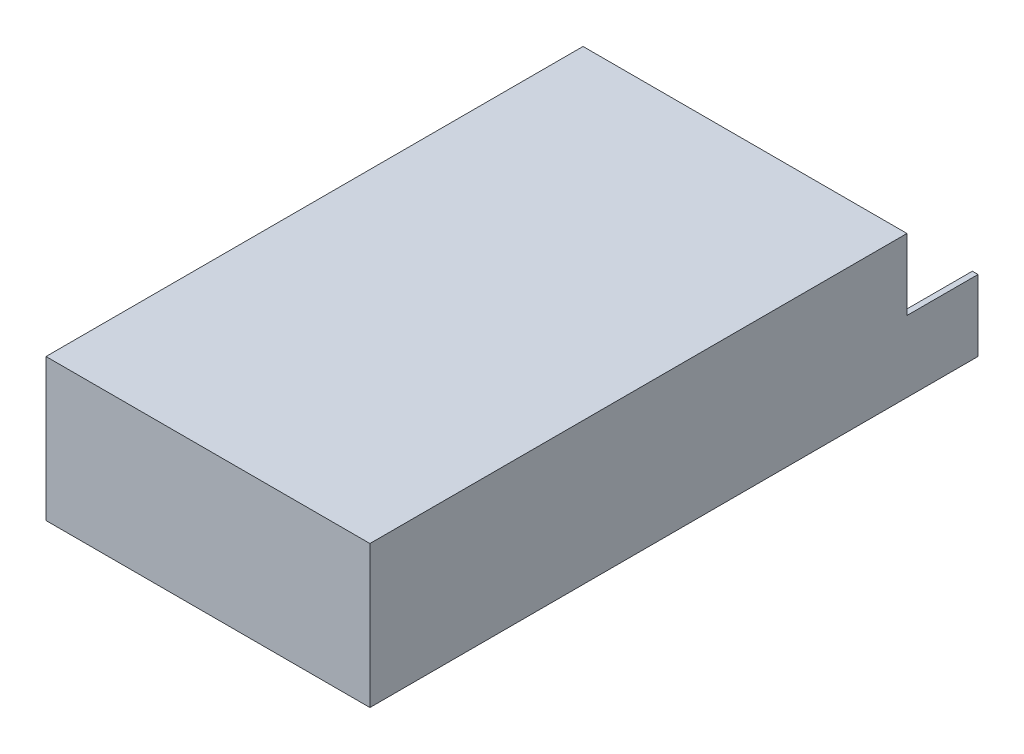
from build123d import *

# Parameters (mm, degrees)
SKETCH1_W                = 114
SKETCH1_H                = 214
BOSS_EXTRUDE1_DEPTH      = 50
SKETCH4_W                = 25
SKETCH4_H                = 25
CUT_EXTRUDE1_DEPTH       = 248.572211688
SHELL1_START             = 2
SHELL1_OUTLINE_W         = 110
SHELL1_OUTLINE_H         = 185
SHELL1_DEPTH             = 46
SHELL1_2_OUTLINE_W       = 110
SHELL1_2_OUTLINE_H       = 27
SHELL1_2_DEPTH           = 23
M4_CLEARANCE_HOLE1_D     = 4.3
M4_CLEARANCE_HOLE1_DEPTH = 4
M4_CLEARANCE_HOLE1_TIP   = 1.291850331


# Read off the part's stored shape, not the designer's step: Shell1
with BuildPart() as part:
    # Sketch1 → Boss-Extrude1 (new body)
    with BuildSketch(Plane(origin=(0, 0, 0), x_dir=(1, 0, 0), z_dir=(0, 1, 0))):
        with Locations((57, 107)):
            Rectangle(SKETCH1_W, SKETCH1_H)
    extrude(amount=BOSS_EXTRUDE1_DEPTH)

    # Sketch4 → Cut-Extrude1 (cut, through all)
    with BuildSketch(Plane(origin=(114, 0, 0), x_dir=(0, 0, -1), z_dir=(1, 0, 0))):
        with Locations((201.5, 37.5)):
            Rectangle(SKETCH4_W, SKETCH4_H)
    extrude(amount=-CUT_EXTRUDE1_DEPTH, mode=Mode.SUBTRACT)

    # Shell1 outline → Shell1 (cut)
    with BuildSketch(Plane(origin=(0, 0, 0), x_dir=(1, 0, 0), z_dir=(0, 1, 0)).offset(SHELL1_START)):
        with Locations((57, 94.5)):
            Rectangle(SHELL1_OUTLINE_W, SHELL1_OUTLINE_H)
    extrude(amount=SHELL1_DEPTH, mode=Mode.SUBTRACT)

    # Shell1 2 outline → Shell1 2 (cut)
    with BuildSketch(Plane(origin=(0, 0, 0), x_dir=(1, 0, 0), z_dir=(0, 1, 0)).offset(SHELL1_START)):
        with Locations((57, 200.5)):
            Rectangle(SHELL1_2_OUTLINE_W, SHELL1_2_OUTLINE_H)
    extrude(amount=SHELL1_2_DEPTH, mode=Mode.SUBTRACT)

    # M4 Clearance Hole1
    with Locations(Plane(origin=(0, 0, 0), x_dir=(-1, 0, 0), z_dir=(0, -1, 0))):
        with Locations((-32, 32), (-57, 107), (-32, 182), (-82, 32), (-82, 182)):
            Hole(M4_CLEARANCE_HOLE1_D / 2, depth=M4_CLEARANCE_HOLE1_DEPTH)
            with Locations((0, 0, -(M4_CLEARANCE_HOLE1_DEPTH + M4_CLEARANCE_HOLE1_TIP / 2))):  # 118° drill point
                Cone(0, M4_CLEARANCE_HOLE1_D / 2, M4_CLEARANCE_HOLE1_TIP, mode=Mode.SUBTRACT)


solid = part.part
